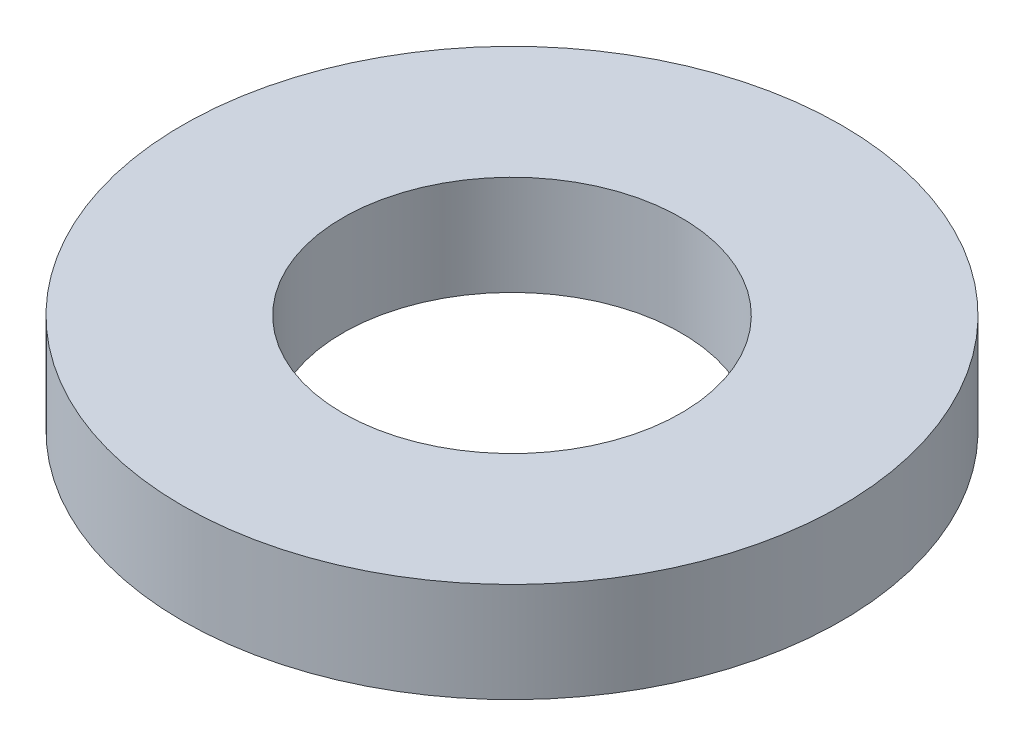
from build123d import *

# Parameters (mm, degrees)
SKETCH1_R           = 92.5
BOSS_EXTRUDE1_DEPTH = 28
SKETCH2_R           = 47.5
CUT_EXTRUDE1_DEPTH  = 134.777800849


with BuildPart() as part:
    # Sketch1 → Boss-Extrude1 (new body)
    with BuildSketch(Plane(origin=(0, 0, 0), x_dir=(1, 0, 0), z_dir=(0, 1, 0))):
        Circle(SKETCH1_R)
    extrude(amount=BOSS_EXTRUDE1_DEPTH)

    # Sketch2 → Cut-Extrude1 (cut, through all)
    with BuildSketch(Plane(origin=(0, 0, 0), x_dir=(1, 0, 0), z_dir=(0, 1, 0))):
        Circle(SKETCH2_R)
    extrude(amount=CUT_EXTRUDE1_DEPTH, mode=Mode.SUBTRACT)


solid = part.part
